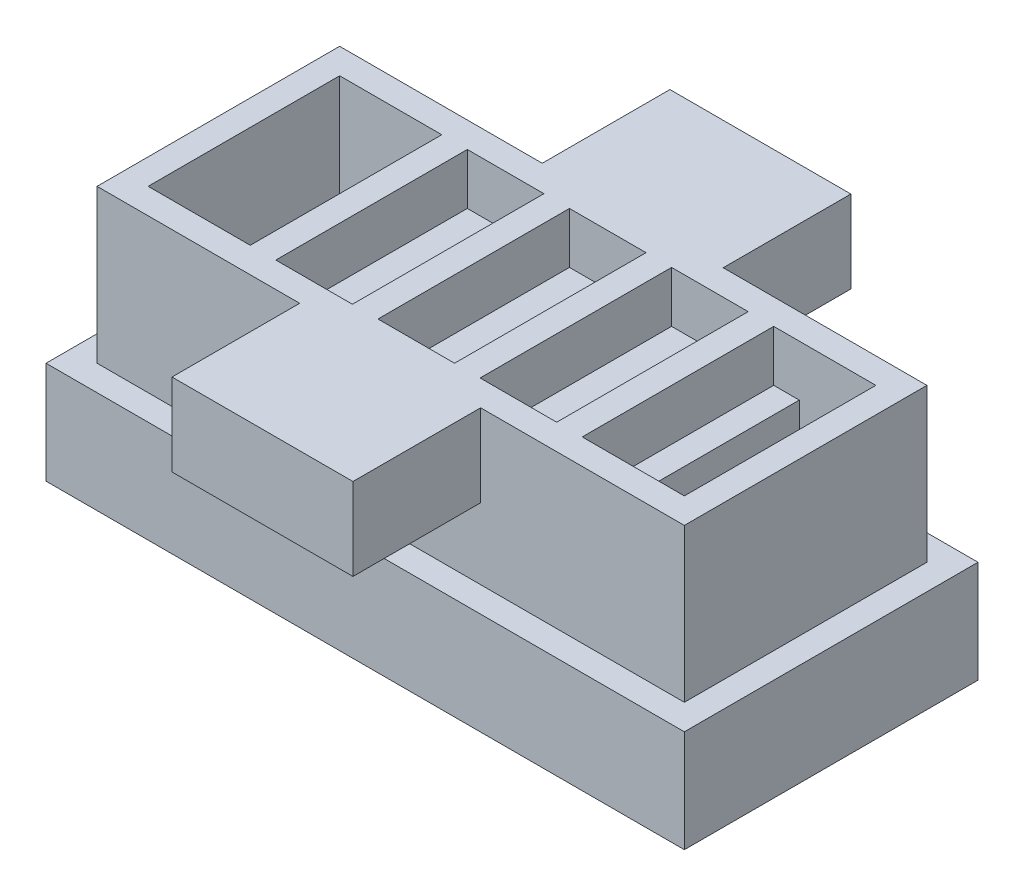
from build123d import *

# Parameters (mm, degrees)
SKETCH1_W                 = 6
SKETCH1_H                 = 15
BOSS_EXTRUDE1_DEPTH       = 15
SKETCH2_W                 = 2
SKETCH2_H                 = 11
CUT_EXTRUDE1_DEPTH        = 13
SKETCH3_W                 = 15
SKETCH3_H                 = 4
BOSS_EXTRUDE2_DEPTH       = 2
LPATTERN1_COUNT           = 5
LPATTERN1_PITCH           = 8
SKETCH6_W                 = 15
SKETCH6_H                 = 15
BOSS_EXTRUDE4_DEPTH       = 2
SKETCH8_W                 = 15
SKETCH8_H                 = 11
BOSS_EXTRUDE5_DEPTH       = 2
SKETCH9_W                 = 34
SKETCH9_H                 = 2
CUT_EXTRUDE2_DEPTH        = 2
SKETCH13_W                = 36
SKETCH13_H                = 13
SKETCH13_W_2              = 34
SKETCH13_H_2              = 11
BOSS_EXTRUDE9_DEPTH       = 2
SKETCH15_W                = 4
SKETCH15_H                = 2.5
BOSS_EXTRUDE10_DEPTH      = 2
LPATTERN2_COUNT           = 4
LPATTERN2_PITCH           = 8
BOSS_EXTRUDE11_DEPTH      = 5
BOSS_EXTRUDE11_DEPTH_BACK = 15
SKETCH17_W                = 46
SKETCH17_H                = 19
SPLIT2_START              = -5
SPLIT2_OUTLINE_W          = 46
SPLIT2_OUTLINE_H          = 19
SPLIT2_DEPTH              = 5
SPLIT2_2_OUTLINE_W        = 2
SPLIT2_2_OUTLINE_H        = 11
SPLIT2_2_DEPTH            = 13
SPLIT2_3_OUTLINE_W        = 6
SPLIT2_3_OUTLINE_H        = 2
SPLIT2_3_DEPTH            = 2
SPLIT2_START_2            = -13
SPLIT2_4_DEPTH            = 11
SPLIT2_START_3            = -17
SPLIT2_5_DEPTH            = 19
SPLIT2_6_OUTLINE_W        = 36
SPLIT2_6_OUTLINE_H        = 2
SPLIT2_6_DEPTH            = 3
SPLIT2_START_4            = -1
SPLIT2_7_OUTLINE_W        = 36
SPLIT2_7_OUTLINE_H        = 2
SPLIT2_7_DEPTH            = 3
SPLIT2_START_5            = -8.5
SPLIT2_8_DEPTH            = 2
SPLIT2_START_6            = -9.5
SPLIT2_9_OUTLINE_W        = 4
SPLIT2_9_OUTLINE_H        = 2
SPLIT2_9_DEPTH            = 4
SPLIT2_10_OUTLINE_W       = 4
SPLIT2_10_OUTLINE_H       = 2
SPLIT2_10_DEPTH           = 1
SPLIT2_START_7            = -3
SPLIT2_11_OUTLINE_W       = 4
SPLIT2_11_OUTLINE_H       = 2
SPLIT2_11_DEPTH           = 1
SKETCH18_W                = 14.174743238
SKETCH18_H                = 6.442150942
BOSS_EXTRUDE12_DEPTH      = 10
SKETCH19_W                = 50
SKETCH19_H                = 23
SKETCH19_W_2              = 46
SKETCH19_H_2              = 19
BOSS_EXTRUDE13_DEPTH      = 8
SKETCH20_W                = 2
SKETCH20_H                = 11
CUT_EXTRUDE3_DEPTH        = 5


# Read off the part's stored shape, not the designer's step: Split2
with BuildPart() as part:
    # Sketch1 → Boss-Extrude1 (new body)
    with BuildSketch(Plane(origin=(0, 0, 0), x_dir=(1, 0, 0), z_dir=(0, 1, 0))):
        with Locations((3, 7.5)):
            Rectangle(SKETCH1_W, SKETCH1_H)
    extrude(amount=BOSS_EXTRUDE1_DEPTH)

    # Sketch2 → Cut-Extrude1 (cut)
    with BuildSketch(Plane.XZ):
        with Locations((3, -7.5)):
            Rectangle(SKETCH2_W, SKETCH2_H)
    extrude(amount=-CUT_EXTRUDE1_DEPTH, mode=Mode.SUBTRACT)

    # Sketch3 → Boss-Extrude2 (add)
    with BuildSketch(Plane.ZY):
        with Locations((-7.5, 2)):
            Rectangle(SKETCH3_W, SKETCH3_H)
    extrude(amount=BOSS_EXTRUDE2_DEPTH)


with BuildPart() as lpattern1_1:
    # LPattern1: pattern copy
    add(part.part.moved(Location(Vector(-1, 0, 0) * (1 * LPATTERN1_PITCH))))


with BuildPart() as lpattern1_2:
    # LPattern1: pattern copy
    add(part.part.moved(Location(Vector(-1, 0, 0) * (2 * LPATTERN1_PITCH))))


with BuildPart() as lpattern1_3:
    # LPattern1: pattern copy
    add(part.part.moved(Location(Vector(-1, 0, 0) * (3 * LPATTERN1_PITCH))))


with BuildPart() as lpattern1_4:
    # LPattern1: pattern copy
    add(part.part.moved(Location(Vector(-1, 0, 0) * (4 * LPATTERN1_PITCH))))


with BuildPart() as lpattern1_1_1:
    add(lpattern1_1.part)

    # Combine1: union LPattern1_2, LPattern1_3, part, LPattern1_4
    add(lpattern1_2.part)
    add(lpattern1_3.part)
    add(part.part)
    add(lpattern1_4.part)

    # Sketch6 → Boss-Extrude4 (add)
    with BuildSketch(Plane(origin=(6, 0, 0), x_dir=(0, 0, -1), z_dir=(1, 0, 0))):
        with Locations((7.5, 7.5)):
            Rectangle(SKETCH6_W, SKETCH6_H)
    extrude(amount=BOSS_EXTRUDE4_DEPTH)

    # Sketch8 → Boss-Extrude5 (add)
    with BuildSketch(Plane.ZY.offset(32)):
        with Locations((-7.5, 9.5)):
            Rectangle(SKETCH8_W, SKETCH8_H)
    extrude(amount=BOSS_EXTRUDE5_DEPTH)

    # Sketch9 → Cut-Extrude2 (cut)
    with BuildSketch(Plane.XZ):
        with Locations((-13, -7.5)):
            Rectangle(SKETCH9_W, SKETCH9_H)
    extrude(amount=-CUT_EXTRUDE2_DEPTH, mode=Mode.SUBTRACT)

    # Sketch13 → Boss-Extrude9 (add)
    with BuildSketch(Plane(origin=(0, 0, 0), x_dir=(-1, 0, 0), z_dir=(0, -1, 0))):
        with Locations((13, 7.5)):
            Rectangle(SKETCH13_W, SKETCH13_H)
        with Locations((13, 7.5)):
            Rectangle(SKETCH13_W_2, SKETCH13_H_2, mode=Mode.SUBTRACT)
    extrude(amount=BOSS_EXTRUDE9_DEPTH)

    # Sketch15 → Boss-Extrude10 (add)
    with BuildSketch(Plane(origin=(0, 0, 0), x_dir=(-1, 0, 0), z_dir=(0, -1, 0))):
        with Locations((25, 4.25)):
            Rectangle(SKETCH15_W, SKETCH15_H)
        with Locations((25, 10.75)):
            Rectangle(SKETCH15_W, SKETCH15_H)
    boss_extrude10 = extrude(amount=BOSS_EXTRUDE10_DEPTH)

    # LPattern2: Boss-Extrude10 ×4
    with Locations(*[(i * LPATTERN2_PITCH, 0, 0) for i in range(1, LPATTERN2_COUNT)]):
        add(boss_extrude10)


with BuildPart() as body_2:
    # Sketch17 → Boss-Extrude11 (new, two sides: drawn at the far end of the back side and taken through both)
    with BuildSketch(Plane.XZ.offset(-BOSS_EXTRUDE11_DEPTH_BACK)):
        with Locations((-13, -7.5)):
            Rectangle(SKETCH17_W, SKETCH17_H)
    extrude(amount=BOSS_EXTRUDE11_DEPTH + BOSS_EXTRUDE11_DEPTH_BACK)

    # Combine3: cut LPattern1_1
    add(lpattern1_1_1.part, mode=Mode.SUBTRACT)

    # Split2 outline → Split2 (cut)
    with BuildSketch(Plane(origin=(0, 0, 0), x_dir=(1, 0, 0), z_dir=(0, 1, 0)).offset(SPLIT2_START)):
        with Locations((-13, 7.5)):
            Rectangle(SPLIT2_OUTLINE_W, SPLIT2_OUTLINE_H)
    extrude(amount=SPLIT2_DEPTH, mode=Mode.SUBTRACT)

    # Split2 2 outline → Split2 2 (cut)
    with BuildSketch(Plane(origin=(0, 0, 0), x_dir=(1, 0, 0), z_dir=(0, 1, 0))):
        with Locations((3, 7.5)):
            Rectangle(SPLIT2_2_OUTLINE_W, SPLIT2_2_OUTLINE_H)
        with Locations((-5, 7.5)):
            Rectangle(SPLIT2_2_OUTLINE_W, SPLIT2_2_OUTLINE_H)
        with Locations((-13, 7.5)):
            Rectangle(SPLIT2_2_OUTLINE_W, SPLIT2_2_OUTLINE_H)
        with Locations((-21, 7.5)):
            Rectangle(SPLIT2_2_OUTLINE_W, SPLIT2_2_OUTLINE_H)
        with Locations((-29, 7.5)):
            Rectangle(SPLIT2_2_OUTLINE_W, SPLIT2_2_OUTLINE_H)
    extrude(amount=SPLIT2_2_DEPTH, mode=Mode.SUBTRACT)

    # Split2 3 outline → Split2 3 (cut)
    with BuildSketch(Plane(origin=(0, 0, 0), x_dir=(1, 0, 0), z_dir=(0, 1, 0))):
        with Locations((-1, 7.5)):
            Rectangle(SPLIT2_3_OUTLINE_W, SPLIT2_3_OUTLINE_H)
        with Locations((-9, 7.5)):
            Rectangle(SPLIT2_3_OUTLINE_W, SPLIT2_3_OUTLINE_H)
        with Locations((-17, 7.5)):
            Rectangle(SPLIT2_3_OUTLINE_W, SPLIT2_3_OUTLINE_H)
        with Locations((-25, 7.5)):
            Rectangle(SPLIT2_3_OUTLINE_W, SPLIT2_3_OUTLINE_H)
    extrude(amount=SPLIT2_3_DEPTH, mode=Mode.SUBTRACT)

    # Sketch18 → Boss-Extrude12 (add)
    with BuildSketch(Plane.XY.offset(2)):
        with Locations((-13.043964225, 11.778924529)):
            Rectangle(SKETCH18_W, SKETCH18_H)
    boss_extrude12 = extrude(amount=BOSS_EXTRUDE12_DEPTH)

    # Mirror2: Boss-Extrude12 across plane
    add(boss_extrude12.mirror(Plane.XY.offset(-7.5)))


with BuildPart() as body_2_2:
    # Split2 4 outline → Split2 4 (new body)
    with BuildSketch(Plane.XY.offset(SPLIT2_START_2)):
        Polygon((-4, 0), (-4, 13), (-6, 13), (-6, 0), (-7, 0), (-7, -2), (-11, -2), (-11, 0), (-12, 0), (-12, 13), (-14, 13), (-14, 0), (-15, 0), (-15, -2), (-19, -2), (-19, 0), (-20, 0), (-20, 13), (-22, 13), (-22, 0), (-23, 0), (-23, -2), (-27, -2), (-27, 0), (-28, 0), (-28, 13), (-30, 13), (-30, -2), (-31, -2), (-31, 0), (-36, 0), (-36, -5), (10, -5), (10, 0), (5, 0), (5, -2), (4, -2), (4, 13), (2, 13), (2, 0), (1, 0), (1, -2), (-3, -2), (-3, 0), align=None)
    extrude(amount=SPLIT2_4_DEPTH)

    # Split2 5 outline → Split2 5 (add)
    with BuildSketch(Plane.XY.offset(SPLIT2_START_3)):
        Polygon((5, -2), (-31, -2), (-31, 0), (-36, 0), (-36, -5), (10, -5), (10, 0), (5, 0), align=None)
    extrude(amount=SPLIT2_5_DEPTH)

    # Split2 6 outline → Split2 6 (add)
    with BuildSketch(Plane.XY.offset(SPLIT2_START_3)):
        with Locations((-13, -1)):
            Rectangle(SPLIT2_6_OUTLINE_W, SPLIT2_6_OUTLINE_H)
    extrude(amount=SPLIT2_6_DEPTH)

    # Split2 7 outline → Split2 7 (add)
    with BuildSketch(Plane.XY.offset(SPLIT2_START_4)):
        with Locations((-13, -1)):
            Rectangle(SPLIT2_7_OUTLINE_W, SPLIT2_7_OUTLINE_H)
    extrude(amount=SPLIT2_7_DEPTH)

    # Split2 8 outline → Split2 8 (add)
    with BuildSketch(Plane.XY.offset(SPLIT2_START_5)):
        Polygon((2, 2), (-4, 2), (-4, 0), (-3, 0), (-3, -2), (1, -2), (1, 0), (2, 0), align=None)
        Polygon((-7, 0), (-6, 0), (-6, 2), (-12, 2), (-12, 0), (-11, 0), (-11, -2), (-7, -2), align=None)
        Polygon((-19, -2), (-15, -2), (-15, 0), (-14, 0), (-14, 2), (-20, 2), (-20, 0), (-19, 0), align=None)
        Polygon((-27, -2), (-23, -2), (-23, 0), (-22, 0), (-22, 2), (-28, 2), (-28, 0), (-27, 0), align=None)
    extrude(amount=SPLIT2_8_DEPTH)

    # Split2 9 outline → Split2 9 (add)
    with BuildSketch(Plane.XY.offset(SPLIT2_START_6)):
        with Locations((-1, -1)):
            Rectangle(SPLIT2_9_OUTLINE_W, SPLIT2_9_OUTLINE_H)
        with Locations((-9, -1)):
            Rectangle(SPLIT2_9_OUTLINE_W, SPLIT2_9_OUTLINE_H)
        with Locations((-17, -1)):
            Rectangle(SPLIT2_9_OUTLINE_W, SPLIT2_9_OUTLINE_H)
        with Locations((-25, -1)):
            Rectangle(SPLIT2_9_OUTLINE_W, SPLIT2_9_OUTLINE_H)
    extrude(amount=SPLIT2_9_DEPTH)

    # Split2 10 outline → Split2 10 (add)
    with BuildSketch(Plane.XY.offset(SPLIT2_START_2)):
        with Locations((-1, -1)):
            Rectangle(SPLIT2_10_OUTLINE_W, SPLIT2_10_OUTLINE_H)
        with Locations((-9, -1)):
            Rectangle(SPLIT2_10_OUTLINE_W, SPLIT2_10_OUTLINE_H)
        with Locations((-17, -1)):
            Rectangle(SPLIT2_10_OUTLINE_W, SPLIT2_10_OUTLINE_H)
        with Locations((-25, -1)):
            Rectangle(SPLIT2_10_OUTLINE_W, SPLIT2_10_OUTLINE_H)
    extrude(amount=SPLIT2_10_DEPTH)

    # Split2 11 outline → Split2 11 (add)
    with BuildSketch(Plane.XY.offset(SPLIT2_START_7)):
        with Locations((-1, -1)):
            Rectangle(SPLIT2_11_OUTLINE_W, SPLIT2_11_OUTLINE_H)
        with Locations((-9, -1)):
            Rectangle(SPLIT2_11_OUTLINE_W, SPLIT2_11_OUTLINE_H)
        with Locations((-17, -1)):
            Rectangle(SPLIT2_11_OUTLINE_W, SPLIT2_11_OUTLINE_H)
        with Locations((-25, -1)):
            Rectangle(SPLIT2_11_OUTLINE_W, SPLIT2_11_OUTLINE_H)
    extrude(amount=SPLIT2_11_DEPTH)

    # Sketch19 → Boss-Extrude13 (add)
    with BuildSketch(Plane.XZ.offset(5)):
        with Locations((-13, -7.5)):
            Rectangle(SKETCH19_W, SKETCH19_H)
        with Locations((-13, -7.5)):
            Rectangle(SKETCH19_W_2, SKETCH19_H_2, mode=Mode.SUBTRACT)
    extrude(amount=-BOSS_EXTRUDE13_DEPTH)

    # Sketch20 → Cut-Extrude3 (cut)
    with BuildSketch(Plane(origin=(0, 13, 0), x_dir=(1, 0, 0), z_dir=(0, 1, 0))):
        with Locations((-29, 7.5)):
            Rectangle(SKETCH20_W, SKETCH20_H)
    extrude(amount=-CUT_EXTRUDE3_DEPTH, mode=Mode.SUBTRACT)


solid = Compound([body_2.part, body_2_2.part])
